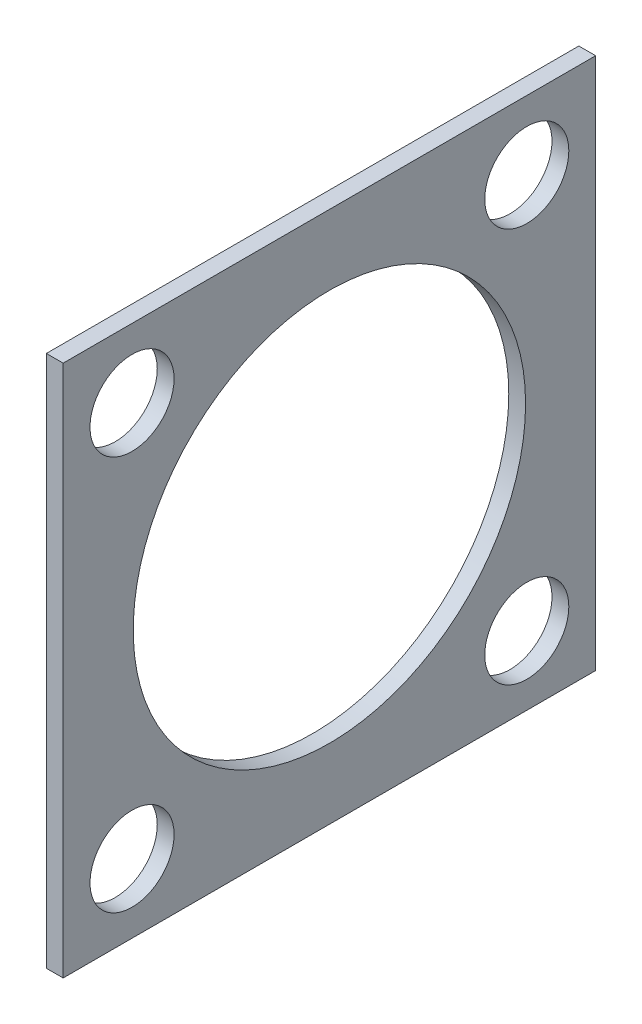
from build123d import *

# Parameters (mm, degrees)
CROQUIS2_W        = 38
CROQUIS2_H        = 38
CROQUIS2_R        = 14
CROQUIS2_R_2      = 3
BRIDA_BASE1_DEPTH = 1.2


# Sheet-metal steps are written as plain solids
with BuildPart() as part:
    # Croquis2 → Brida base1 (new body)
    with BuildSketch(Plane(origin=(0, 0, 0), x_dir=(0, 0, -1), z_dir=(1, 0, 0))):
        Rectangle(CROQUIS2_W, CROQUIS2_H)
        Circle(CROQUIS2_R, mode=Mode.SUBTRACT)
        with Locations((-14.085, -14.085)):
            Circle(CROQUIS2_R_2, mode=Mode.SUBTRACT)
        with Locations((-14.085, 14.085)):
            Circle(CROQUIS2_R_2, mode=Mode.SUBTRACT)
        with Locations((14.085, 14.085)):
            Circle(CROQUIS2_R_2, mode=Mode.SUBTRACT)
        with Locations((14.085, -14.085)):
            Circle(CROQUIS2_R_2, mode=Mode.SUBTRACT)
    extrude(amount=-BRIDA_BASE1_DEPTH)


solid = part.part
